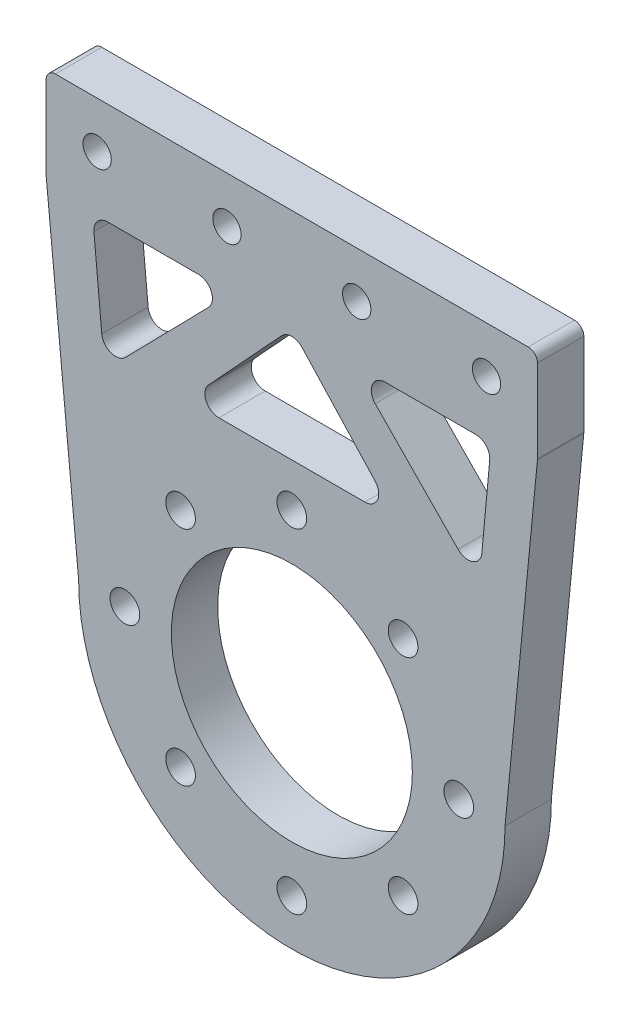
from build123d import *

# Parameters (mm, degrees)
EXTRUDE_2_DEPTH          = 5
FILLET_3_R               = 1
SKETCH_3_R               = 13
SKETCH_3_R_2             = 1.6
CUT_EXTRUDE_5_DEPTH      = 5
CUT_EXTRUDE_6_DEPTH      = 54.322134241
CUT_EXTRUDE_6_DEPTH_BACK = 54.322134241
SKETCH_4_R               = 1.525
CUT_EXTRUDE_7_DEPTH      = 10
FILLET_4_R               = 1.5


with BuildPart() as part:
    # 草圖2 → 填料-伸長2 (new body)
    with BuildSketch(Plane.XY):
        with BuildLine():
            Line((-26.5, 46), (26.5, 46))
            Line((26.5, 46), (26.5, 36))
            Line((26.5, 36), (23, 0))
            ThreePointArc((23, 0), (0, -23), (-23, 0))
            Line((-23, 0), (-26.5, 36))
            Line((-26.5, 36), (-26.5, 46))
        make_face()
    extrude(amount=EXTRUDE_2_DEPTH)

    # 圓角3
    # the kernel refuses this fillet: 1 mm, written as the material it takes off along each edge
    with BuildSketch(Plane(origin=(-26.5, 46, -2.5), x_dir=(0, -1, 0), z_dir=(0, 0, 1)), Plane(origin=(26.5, 46, -2.5), x_dir=(-1, 0, 0), z_dir=(0, 0, 1))) as fillet_3_piece_1:
        with BuildLine():
            CenterArc((FILLET_3_R, FILLET_3_R), FILLET_3_R, 180, 90)
            Line((0, FILLET_3_R), (0, 0))
            Line((0, 0), (FILLET_3_R, 0))
        make_face()
    extrude(amount=10, mode=Mode.SUBTRACT)
    with BuildSketch(Plane(origin=(26.5, 36, -0.121241952), x_dir=(0, 1, 0), z_dir=(0, 0, 1)), Plane(origin=(-26.5, 36, -0.121241952), x_dir=(0.0967659740606196, -0.9953071617667079, 0), z_dir=(0, 0, 1))) as fillet_3_piece_2:
        with BuildLine():
            CenterArc((FILLET_3_R * 0.0484967808039, FILLET_3_R), FILLET_3_R, 264.447028967, 5.552971033)
            Line((-FILLET_3_R * 0.0482691932568, FILLET_3_R * 0.0046928382333), (0, 0))
            Line((0, 0), (FILLET_3_R * 0.0484967808039, 0))
        make_face()
    extrude(amount=5.242483904, mode=Mode.SUBTRACT)

    # 草圖3 → 除料-伸長5 (cut)
    with BuildSketch(Plane.XY):
        Circle(SKETCH_3_R)
        with Locations((18.009998301, 0)):
            Circle(SKETCH_3_R_2)
        with Locations((0, -18.009998301)):
            Circle(SKETCH_3_R_2)
        with Locations((-18.009998301, 0)):
            Circle(SKETCH_3_R_2)
        with Locations((0, 18.009998301)):
            Circle(SKETCH_3_R_2)
        with Locations((11.999602077, 11.999602077)):
            Circle(SKETCH_3_R_2)
        with Locations((11.999602077, -11.999602077)):
            Circle(SKETCH_3_R_2)
        with Locations((-11.999602077, -11.999602077)):
            Circle(SKETCH_3_R_2)
        with Locations((-11.999602077, 11.999602077)):
            Circle(SKETCH_3_R_2)
    extrude(amount=CUT_EXTRUDE_5_DEPTH, mode=Mode.SUBTRACT)

    # 草圖4 → 除料-伸長6 (cut, two sides: drawn at the far end of the back side and taken through both)
    with BuildSketch(Plane.XY.offset(-CUT_EXTRUDE_6_DEPTH_BACK)):
        with Locations((21, 41)):
            Circle(SKETCH_4_R)
        with Locations((7, 41)):
            Circle(SKETCH_4_R)
        with Locations((-7, 41)):
            Circle(SKETCH_4_R)
        with Locations((-21, 41)):
            Circle(SKETCH_4_R)
    extrude(amount=CUT_EXTRUDE_6_DEPTH + CUT_EXTRUDE_6_DEPTH_BACK, mode=Mode.SUBTRACT)

    # 草圖5 → 除料-伸長7 (cut)
    with BuildSketch(Plane.XY.offset(5)):
        Polygon((-21.5, 35), (-6.5, 35), (-20.2, 21), align=None)
        Polygon((11.3, 22.7), (-11.3, 22.7), (0, 34.95), align=None)
        Polygon((6.5, 35), (20.2, 21), (21.5, 35), align=None)
    extrude(amount=-CUT_EXTRUDE_7_DEPTH, mode=Mode.SUBTRACT)

    # 圓角4
    fillet_4_edges = [part.edges().sort_by_distance(p)[0] for p in [
        (6.5, 35, 2.5),
        (21.5, 35, 2.5),
        (20.2, 21, 2.5),
        (-11.3, 22.7, 2.5),
        (0, 34.95, 2.5),
        (11.3, 22.7, 2.5),
        (-20.2, 21, 2.5),
        (-21.5, 35, 2.5),
        (-6.5, 35, 2.5),
    ]]
    fillet(fillet_4_edges, radius=FILLET_4_R)


solid = part.part
